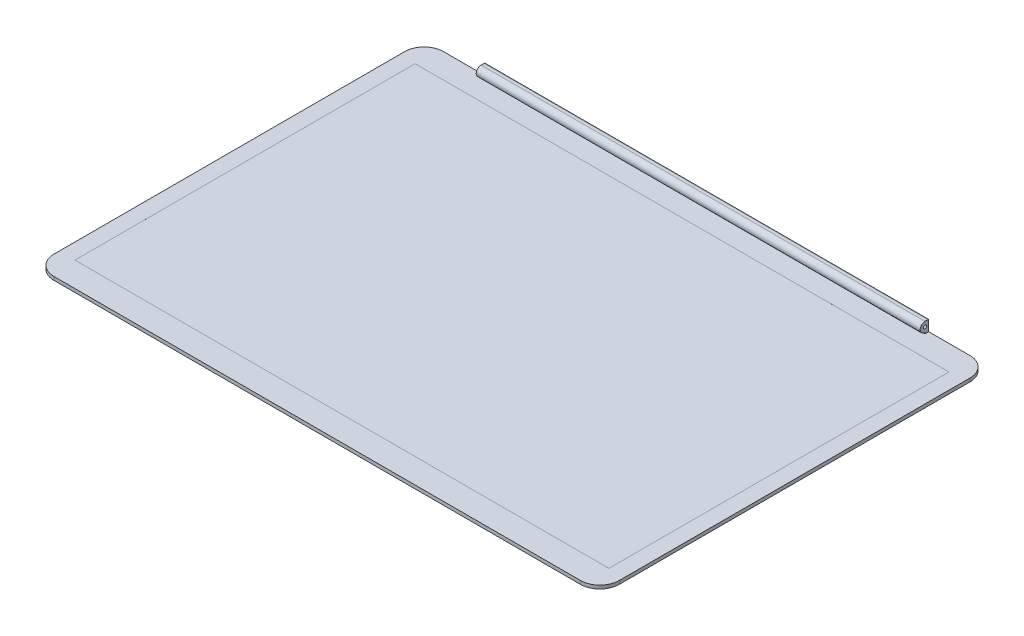
from build123d import *

# Parameters (mm, degrees)
BOSS_EXTRUDE1_DEPTH   = 174.65
BOSS_EXTRUDE2_DEPTH   = 295.3
BOSS_EXTRUDE2_2_DEPTH = 295.3
CUT_EXTRUDE1_DEPTH    = 564.747214252
FILLET1_R             = 12
CUT_EXTRUDE2_DEPTH    = 3.5
SKETCH6_R             = 1
BOSS_EXTRUDE3_DEPTH   = 137.15
SKETCH7_W             = 329.889597284
SKETCH7_H             = 210.188009182
CUT_EXTRUDE3_DEPTH    = 0.0001
CUT_EXTRUDE4_START    = -0.01
CUT_EXTRUDE4_DEPTH    = 0.01


# Read off the part's stored shape, not the designer's step: Cut-Extrude4
with BuildPart() as part:
    # Sketch1 → Boss-Extrude1 (new, symmetric)
    with BuildSketch(Plane(origin=(0, 0, 0), x_dir=(0, 0, -1), z_dir=(1, 0, 0))):
        with BuildLine():
            Line((120.35, 2.092995949), (-120.35, 2.092995949))
            Line((-120.35, 2.092995949), (-120.35, -0.007004051))
            ThreePointArc((-120.35, -0.007004051), (-106.953525194, -2.555626976), (-93.35, -3.507004051))
            Line((-93.35, -3.507004051), (93.35, -3.507004051))
            ThreePointArc((93.35, -3.507004051), (106.953525194, -2.555626976), (120.35, -0.007004051))
            Line((120.35, -0.007004051), (120.35, 2.092995949))
        make_face()
    extrude(amount=BOSS_EXTRUDE1_DEPTH, both=True)


with BuildPart() as body_2:
    # Sketch3 → Boss-Extrude2 (new body)
    with BuildSketch(Plane(origin=(0, 0, -120.35), x_dir=(-1, 0, 0), z_dir=(0, 0, -1))):
        with BuildLine():
            Line((174.65, -3.507004051), (174.65, -0.007004051))
            ThreePointArc((174.65, -0.007004051), (161.253525194, -2.555626976), (147.65, -3.507004051))
            Line((147.65, -3.507004051), (174.65, -3.507004051))
        make_face()
    extrude(amount=BOSS_EXTRUDE2_DEPTH)


with BuildPart() as body_3:
    # Sketch3 → Boss-Extrude2 2 (new body)
    with BuildSketch(Plane(origin=(0, 0, -120.35), x_dir=(-1, 0, 0), z_dir=(0, 0, -1))):
        with BuildLine():
            Line((-174.65, -3.507004051), (-147.65, -3.507004051))
            ThreePointArc((-147.65, -3.507004051), (-161.253525194, -2.555626976), (-174.65, -0.007004051))
            Line((-174.65, -0.007004051), (-174.65, -3.507004051))
        make_face()
    extrude(amount=BOSS_EXTRUDE2_2_DEPTH)


with BuildPart() as cut_extrude1_tool:
    # Sketch4 → Cut-Extrude1 (new, through all)
    with BuildSketch(Plane(origin=(0, 0, -415.65), x_dir=(-1, 0, 0), z_dir=(0, 0, -1))):
        with BuildLine():
            Line((-174.65, -0.007004051), (-174.65, -3.507004051))
            Line((-174.65, -3.507004051), (-147.65, -3.507004051))
            ThreePointArc((-147.65, -3.507004051), (-161.253525194, -2.555626976), (-174.65, -0.007004051))
        make_face()
        with BuildLine():
            Line((174.65, -3.507004051), (174.65, -0.007004051))
            ThreePointArc((174.65, -0.007004051), (161.253525194, -2.555626976), (147.65, -3.507004051))
            Line((147.65, -3.507004051), (174.65, -3.507004051))
        make_face()
    extrude(amount=-CUT_EXTRUDE1_DEPTH)


with BuildPart() as part_1:
    add(part.part)

    # Cut-Extrude1: cut by cut_extrude1_tool
    add(cut_extrude1_tool.part, mode=Mode.SUBTRACT)

    # Fillet1
    fillet1_edges = [part_1.edges().sort_by_distance(p)[0] for p in [
        (-174.65, 1.042995949, 120.35),
        (-174.65, 1.042995949, -120.35),
        (174.65, 1.042995949, -120.35),
        (174.65, 1.042995949, 120.35),
    ]]
    fillet(fillet1_edges, radius=FILLET1_R)

    # Sketch5 → Cut-Extrude2 (cut)
    with BuildSketch(Plane.XZ.offset(3.507004051)):
        Polygon((147.65, -93.35), (210.030677808, -93.35), (147.65, -135.593204027), align=None)
        Polygon((147.65, 93.35), (239.751162266, 93.35), (147.65, 176.927939597), align=None)
        Polygon((-147.65, -93.35), (-147.65, -130.932477463), (-221.764343706, -93.35), align=None)
        Polygon((-147.65, 93.35), (-147.65, 153.997058362), (-221.764343706, 93.35), align=None)
    extrude(amount=-CUT_EXTRUDE2_DEPTH, mode=Mode.SUBTRACT)

    # Sketch6 → Boss-Extrude3 (add, symmetric)
    with BuildSketch(Plane(origin=(0, 0, 0), x_dir=(0, 0, -1), z_dir=(1, 0, 0))):
        with BuildLine():
            Line((118.05, 2.092995949), (118.05, 2.792995949))
            ThreePointArc((118.05, 2.792995949), (115.05, 5.792995949), (118.05, 8.792995949))
            Line((118.05, 8.792995949), (119.85, 8.792995949))
            Line((119.85, 8.792995949), (120.35, 8.692497192))
            Line((120.35, 8.692497192), (120.35, 2.092995949))
            Line((120.35, 2.092995949), (118.05, 2.092995949))
        make_face()
        with Locations((118.05, 5.792995949)):
            Circle(SKETCH6_R, mode=Mode.SUBTRACT)
    extrude(amount=BOSS_EXTRUDE3_DEPTH, both=True)

    # Sketch7 → Cut-Extrude3 (cut)
    with BuildSketch(Plane(origin=(0, 2.092995949, 0), x_dir=(1, 0, 0), z_dir=(0, 1, 0))):
        Rectangle(SKETCH7_W, SKETCH7_H)
    extrude(amount=-CUT_EXTRUDE3_DEPTH, mode=Mode.SUBTRACT)

    # Cut-Extrude4 outline → Cut-Extrude4 (cut)
    with BuildSketch(Plane.XZ.offset(3.507004051).offset(CUT_EXTRUDE4_START)):
        with BuildLine():
            ThreePointArc((-9.086829944, -21.248513597), (-8.191165567, -21.790889583), (-7.183580977, -22.075774961))
            ThreePointArc((-7.183580977, -22.075774961), (-4.970587657, -21.901814224), (-2.834351243, -21.298410749))
            ThreePointArc((-2.834351243, -21.298410749), (1.47428793, -20.400086874), (5.741103254, -21.479736959))
            ThreePointArc((5.741103254, -21.479736959), (9.465377292, -21.935634067), (12.714193917, -20.058601881))
            ThreePointArc((12.714193917, -20.058601881), (14.894750295, -17.768517515), (16.507432012, -15.048486227))
            ThreePointArc((16.507432012, -15.048486227), (17.713556536, -12.779271655), (18.609414677, -10.370639402))
            ThreePointArc((18.609414677, -10.370639402), (12.55251676, -2.119122901), (17.521225226, 6.829925827))
            ThreePointArc((17.521225226, 6.829925827), (13.797071641, 10.184140705), (8.911774187, 11.303938081))
            ThreePointArc((8.911774187, 11.303938081), (6.564348471, 11.150629708), (4.297695677, 10.521188635))
            ThreePointArc((4.297695677, 10.521188635), (2.765098172, 9.975602694), (1.214652309, 9.48302097))
            ThreePointArc((1.214652309, 9.48302097), (0.470107822, 9.356963669), (-0.274436665, 9.48302097))
            ThreePointArc((-0.274436665, 9.48302097), (-2.679371626, 10.302682573), (-5.125261124, 10.990564736))
            ThreePointArc((-5.125261124, 10.990564736), (-7.799066446, 11.233685421), (-10.418034599, 10.642628414))
            ThreePointArc((-10.418034599, 10.642628414), (-14.82861028, 7.663775104), (-17.589225206, 3.113417964))
            ThreePointArc((-17.589225206, 3.113417964), (-18.344964165, -3.082267775), (-17.251311031, -9.22731342))
            ThreePointArc((-17.251311031, -9.22731342), (-14.092597967, -15.865148937), (-9.086829944, -21.248513597))
        make_face()
        with BuildLine():
            ThreePointArc((9.379881835, 21.777318235), (2.623777692, 18.44062415), (0.205889652, 11.303938081))
            ThreePointArc((0.205889652, 11.303938081), (6.961993795, 14.640632167), (9.379881835, 21.777318235))
        make_face()
    extrude(amount=CUT_EXTRUDE4_DEPTH, mode=Mode.SUBTRACT)


with BuildPart() as body_2_1:
    add(body_2.part)

    # Cut-Extrude1: cut by cut_extrude1_tool
    add(cut_extrude1_tool.part, mode=Mode.SUBTRACT)


with BuildPart() as body_3_1:
    add(body_3.part)

    # Cut-Extrude1: cut by cut_extrude1_tool
    add(cut_extrude1_tool.part, mode=Mode.SUBTRACT)


solid = part_1.part
